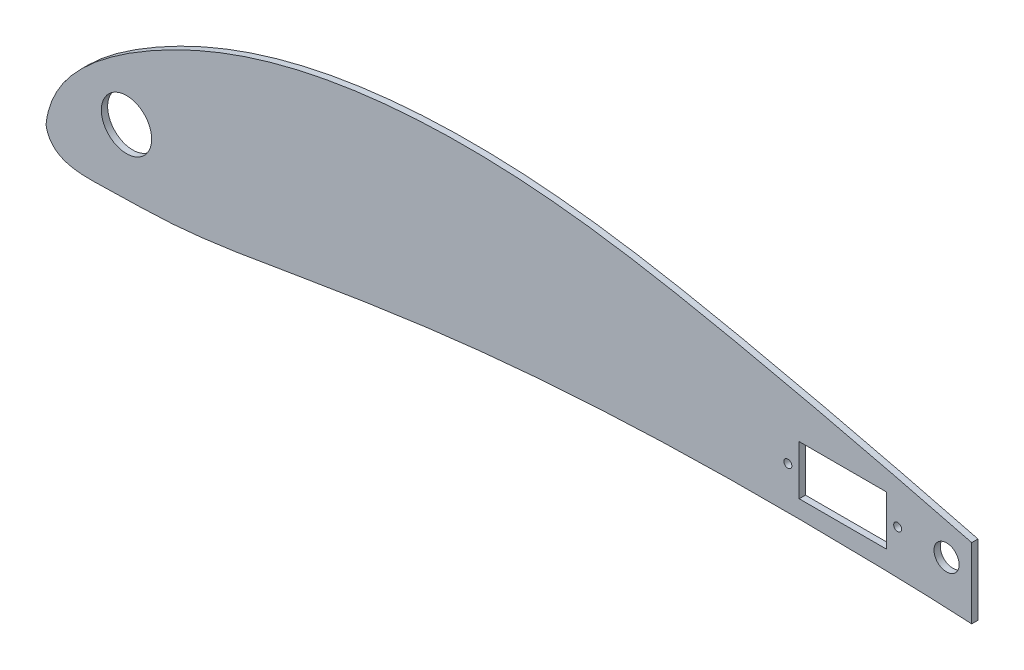
from build123d import *

# Parameters (mm, degrees)
BOSS_EXTRUDE1_DEPTH = 1.5875
SKETCH2_R           = 6.35
SKETCH2_R_2         = 3.175
CUT_EXTRUDE1_DEPTH  = 316.731983488
SKETCH3_W           = 116.84
SKETCH3_H           = 50.8
CUT_EXTRUDE2_DEPTH  = 316.731983488
SKETCH4_R           = 1.00076
SKETCH4_W           = 22
SKETCH4_H           = 12.5
CUT_EXTRUDE3_DEPTH  = 239.581081252


with BuildPart() as part:
    # Sketch1 → Boss-Extrude1 (new body)
    with BuildSketch(Plane.XY):
        with BuildLine():
            add(Edge.make_bspline(
                [(0.000560351, 0.000130087), (0.810633127, 7.359196055), (8.649092025, 17.856605174), (26.286719818, 29.975176328), (52.111128271, 42.069215275), (89.597618475, 49.290763054), (131.400792109, 47.884831915), (173.256699242, 40.041104278), (217.961060472, 29.612974894), (256.952064401, 19.528920948), (290.35983767, 8.71099439), (301.273197721, 4.382828139), (314.816918223, -0.516206742), (309.846313895, 0.000130087)],
                knots=[0, 0, 0, 0, 0.060863618, 0.113688265, 0.188608742, 0.312908923, 0.448482434, 0.557612135, 0.691544113, 0.852438279, 0.92975597, 0.976058229, 1, 1, 1, 1], degree=3))
            add(Edge.make_bspline(
                [(309.846313895, 0.000130087), (303.956832565, 1.47095521), (293.989507544, 2.093987313), (276.26402299, 4.514356704), (260.846344817, 5.427413394), (235.858814759, 7.870306192), (205.101424636, 8.838080282), (157.718638092, 9.030650149), (110.497331172, 6.181495223), (66.506197185, -0.586669107), (36.454672816, -6.098499901), (15.316603331, -6.189065841), (1.230714189, -6.924076091), (0.000560351, 0.000130087)],
                knots=[0, 0, 0, 0, 0.057787081, 0.095274891, 0.171021118, 0.205339302, 0.335319146, 0.464904334, 0.658702312, 0.785511947, 0.893517288, 0.94309214, 1, 1, 1, 1], degree=3))
        make_face()
    extrude(amount=BOSS_EXTRUDE1_DEPTH)

    # Sketch2 → Cut-Extrude1 (cut, through all)
    with BuildSketch(Plane.XY.offset(1.5875)):
        with Locations((20.32, 10.16)):
            Circle(SKETCH2_R)
        with Locations((227.296313895, 19.050130087)):
            Circle(SKETCH2_R_2)
    extrude(amount=-CUT_EXTRUDE1_DEPTH, mode=Mode.SUBTRACT)

    # Sketch3 → Cut-Extrude2 (cut, through all)
    with BuildSketch(Plane.XY.offset(1.5875)):
        with Locations((292.066313895, 19.050130087)):
            Rectangle(SKETCH3_W, SKETCH3_H)
    extrude(amount=-CUT_EXTRUDE2_DEPTH, mode=Mode.SUBTRACT)

    # Sketch4 → Cut-Extrude3 (cut, through all)
    with BuildSketch(Plane.XY.offset(1.5875)):
        with Locations((214.949245332, 19.518092278)):
            Circle(SKETCH4_R)
        with Locations((187.249245332, 19.518092278)):
            Circle(SKETCH4_R)
        with Locations((201.099245332, 19.518092278)):
            Rectangle(SKETCH4_W, SKETCH4_H)
    extrude(amount=-CUT_EXTRUDE3_DEPTH, mode=Mode.SUBTRACT)


solid = part.part
